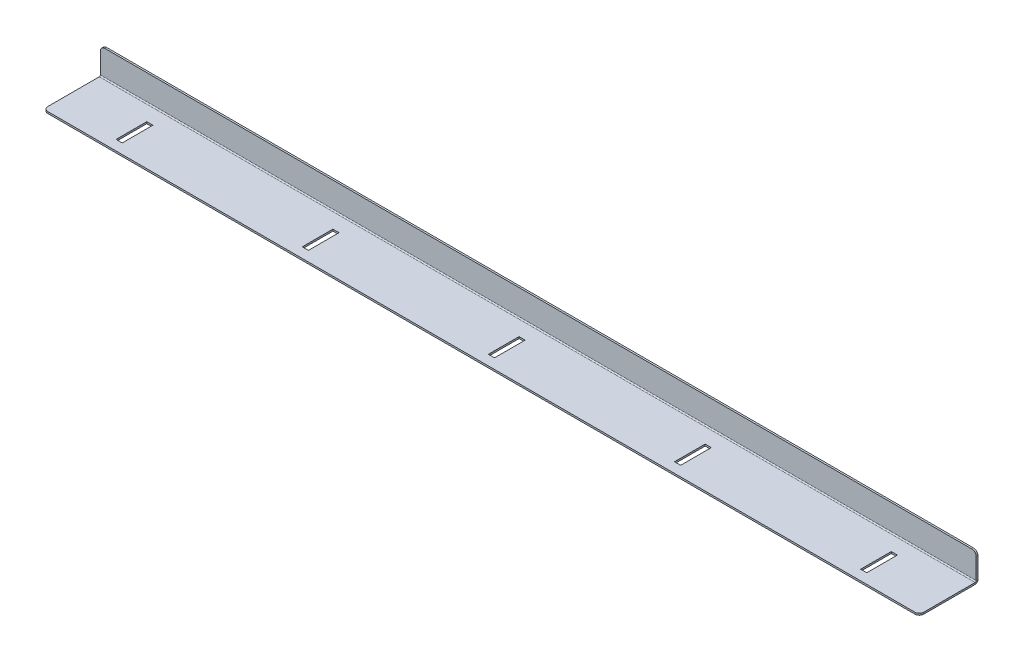
from build123d import *

# Parameters (mm, degrees)
BASE_FLANGE1_DEPTH = 500
FILLET1_R          = 5
SKETCH2_W          = 7
SKETCH2_H          = 35
CUT_EXTRUDE1_DEPTH = 10


# Sheet-metal steps are written as plain solids
with BuildPart() as part:
    # Sketch1 → Base-Flange1 (new, symmetric)
    with BuildSketch(Plane(origin=(0, 0, 0), x_dir=(0, 0, -1), z_dir=(1, 0, 0))):
        with BuildLine():
            Line((-65, 0), (-1.3, 0))
            ThreePointArc((-1.3, 0), (-0.380761184, 0.380761184), (0, 1.3))
            Line((0, 1.3), (0, 30))
            Line((0, 30), (2, 30))
            Line((2, 30), (2, 1.3))
            ThreePointArc((2, 1.3), (1.033452378, -1.033452378), (-1.3, -2))
            Line((-1.3, -2), (-65, -2))
            Line((-65, -2), (-65, 0))
        make_face()
    extrude(amount=BASE_FLANGE1_DEPTH, both=True)

    # Fillet1
    fillet1_edges = [part.edges().sort_by_distance(p)[0] for p in [
        (500, -1, 65),
        (-500, -1, 65),
        (500, 30, -1),
        (-500, 30, -1),
    ]]
    fillet(fillet1_edges, radius=FILLET1_R)

    # Sketch2 → Cut-Extrude1 (cut)
    with BuildSketch(Plane(origin=(0, 0, 0), x_dir=(1, 0, 0), z_dir=(0, 1, 0))):
        with Locations((-425, -36)):
            Rectangle(SKETCH2_W, SKETCH2_H)
        with Locations((-212.5, -36)):
            Rectangle(SKETCH2_W, SKETCH2_H)
        with Locations((0, -36)):
            Rectangle(SKETCH2_W, SKETCH2_H)
        with Locations((212.5, -36)):
            Rectangle(SKETCH2_W, SKETCH2_H)
        with Locations((425, -36)):
            Rectangle(SKETCH2_W, SKETCH2_H)
    extrude(amount=-CUT_EXTRUDE1_DEPTH, mode=Mode.SUBTRACT)


solid = part.part
